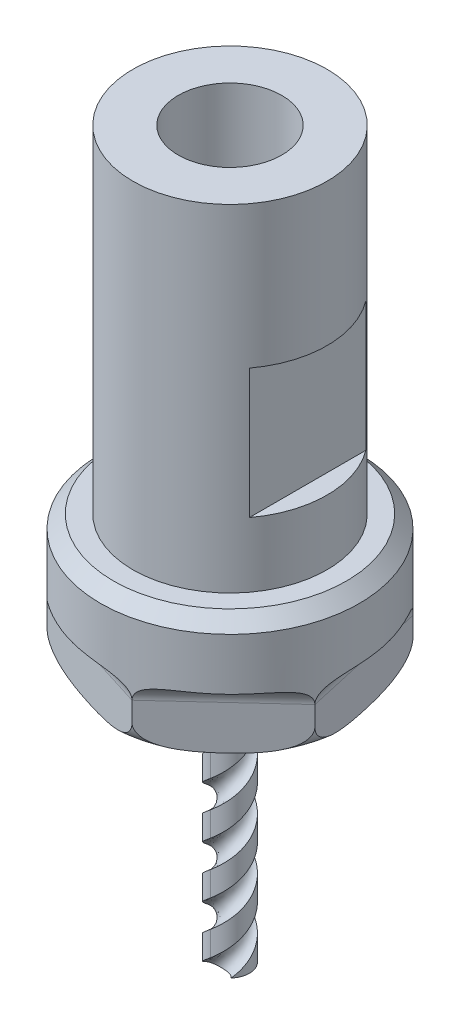
from build123d import *

# Parameters (mm, degrees)
SKETCH_1_R               = 7.5
SKETCH_1_R_2             = 4
EXTRUDE_1_DEPTH          = 26
CUT_EXTRUDE_1_DEPTH      = 10
CUT_EXTRUDE_4_DEPTH      = 5
FILLET_17_R              = 1.5
FILLET_18_R              = 1.5
SKETCH_11_R              = 1.5
EXTRUDE_4_DEPTH          = 20
SWEEP_3_PITCH            = 8
PATTERN_CIRCULAR_1_COUNT = 2


with BuildPart() as part:
    # 草图1 → 凸台-拉伸1 (new body)
    with BuildSketch(Plane(origin=(0, 0, 0), x_dir=(1, 0, 0), z_dir=(0, 1, 0))):
        with Locations(Location((0, 0, 0), (0, 0, 90))):
            Circle(SKETCH_1_R)
        with Locations(Location((0, 0, 0), (0, 0, 90))):
            Circle(SKETCH_1_R_2, mode=Mode.SUBTRACT)
    extrude(amount=EXTRUDE_1_DEPTH)

    # 草图4 → 切除-拉伸1 (cut)
    with BuildSketch(Plane(origin=(0, 5, 0), x_dir=(1, 0, 0), z_dir=(0, 1, 0))):
        with BuildLine():
            Line((-6, 4.5), (-6, -4.5))
            ThreePointArc((-6, -4.5), (-7.5, 0), (-6, 4.5))
        make_face()
        with BuildLine():
            Line((6, 4.5), (6, -4.5))
            ThreePointArc((6, -4.5), (7.5, 0), (6, 4.5))
        make_face()
    extrude(amount=CUT_EXTRUDE_1_DEPTH, mode=Mode.SUBTRACT)

    # 草图9 → 旋转1 (revolve)
    with BuildSketch(Plane.XY, mode=Mode.PRIVATE) as revolve_1_sk:
        with BuildLine():
            Line((0, 0), (9, 0))
            Line((9, 0), (10, -1))
            Line((10, -1), (10, -8))
            ThreePointArc((10, -8), (9.414213562, -9.414213562), (8, -10))
            Line((8, -10), (0, -10))
            Line((0, -10), (0, 0))
        make_face()
    revolve(revolve_1_sk.sketch.rotate(Axis((0, 31.384880557, 0), (0, -1, 0)), 90), axis=Axis((0, 31.384880557, 0), (0, -1, 0)))

    # 草图10 → 切除-拉伸4 (cut)
    with BuildSketch(Plane.XZ.offset(10)):
        with BuildLine():
            Line((9.543902231, 2.985620573), (7.357574378, -6.772451497))
            ThreePointArc((7.357574378, -6.772451497), (9.316000853, -3.634849118), (10, 0))
            ThreePointArc((10, 0), (9.885317959, 1.510128751), (9.543902231, 2.985620573))
        make_face()
        with BuildLine():
            Line((2.186327854, 9.75807207), (9.543902231, 2.985620573))
            ThreePointArc((9.543902231, 2.985620573), (6.772451497, 7.357574378), (2.186327854, 9.75807207))
        make_face()
        with BuildLine():
            Line((-7.357574378, 6.772451497), (2.186327854, 9.75807207))
            ThreePointArc((2.186327854, 9.75807207), (-2.985620573, 9.543902231), (-7.357574378, 6.772451497))
        make_face()
        with BuildLine():
            ThreePointArc((-7.357574378, 6.772451497), (-9.75807207, 2.186327854), (-9.543902231, -2.985620573))
            Line((-9.543902231, -2.985620573), (-7.357574378, 6.772451497))
        make_face()
        with BuildLine():
            ThreePointArc((-9.543902231, -2.985620573), (-6.772451497, -7.357574378), (-2.186327854, -9.75807207))
            Line((-2.186327854, -9.75807207), (-9.543902231, -2.985620573))
        make_face()
        with BuildLine():
            ThreePointArc((-2.186327854, -9.75807207), (2.985620573, -9.543902231), (7.357574378, -6.772451497))
            Line((7.357574378, -6.772451497), (-2.186327854, -9.75807207))
        make_face()
    extrude(amount=-CUT_EXTRUDE_4_DEPTH, mode=Mode.SUBTRACT)

    # 圆角17
    # the kernel refuses this fillet: 1.5 mm, written as the material it adds along each edge
    with BuildSketch(Plane(origin=(10.936537714, -5, -5.652843782), x_dir=(0.29856205726474244, 0, -0.9543902231067984), z_dir=(-0.9543902231067986, 0, -0.29856205726474244))) as fillet_17_piece_1_section:
        with BuildLine():
            CenterArc((FILLET_17_R, FILLET_17_R), FILLET_17_R, 180, 90)
            Line((0, FILLET_17_R), (0, 0))
            Line((0, 0), (FILLET_17_R, 0))
        make_face()
    fillet_17_piece_1 = extrude(amount=17.5, mode=Mode.PRIVATE)
    fillet_17_piece_1 = fillet_17_piece_1 & Plane(origin=(0, -5, 0), x_dir=(0, 0, 1), z_dir=(0, -1, 0)) * Cylinder(10, 42, mode=Mode.PRIVATE)
    fillet_17_piece_1 = split(fillet_17_piece_1, bisect_by=Plane(origin=(2.872004531, -5, -14.414132474), z_dir=(0.6772451497016146, 0, 0.7357574377508104)), keep=Keep.TOP, mode=Mode.PRIVATE)
    fillet_17_piece_1 = split(fillet_17_piece_1, bisect_by=Plane(origin=(7.76751085, -5, -4.942812984), z_dir=(-0.975807206966357, 0, 0.21863278535598768)), keep=Keep.TOP, mode=Mode.PRIVATE)
    add(fillet_17_piece_1)
    with BuildSketch(Plane(origin=(-0.572762538, -5, 12.297741381), x_dir=(0.6772451497016146, 0, 0.7357574377508104), z_dir=(0.7357574377508105, 0, -0.6772451497016146))) as fillet_17_piece_2_section:
        with BuildLine():
            CenterArc((FILLET_17_R, FILLET_17_R), FILLET_17_R, 180, 90)
            Line((0, FILLET_17_R), (0, 0))
            Line((0, 0), (FILLET_17_R, 0))
        make_face()
    fillet_17_piece_2 = extrude(amount=17.5, mode=Mode.PRIVATE)
    fillet_17_piece_2 = fillet_17_piece_2 & Plane(origin=(0, -5, 0), x_dir=(0, 0, 1), z_dir=(0, -1, 0)) * Cylinder(10, 41, mode=Mode.PRIVATE)
    fillet_17_piece_2 = split(fillet_17_piece_2, bisect_by=Plane(origin=(0.396846185, -5, 9.198268212), z_dir=(0.2985620572647422, 0, -0.9543902231067986)), keep=Keep.TOP, mode=Mode.PRIVATE)
    fillet_17_piece_2 = split(fillet_17_piece_2, bisect_by=Plane(origin=(11.04700263, -5, 9.694295121), z_dir=(-0.975807206966357, 0, 0.21863278535598768)), keep=Keep.TOP, mode=Mode.PRIVATE)
    add(fillet_17_piece_2)
    with BuildSketch(Plane(origin=(-10.363775176, -5, -6.644897599), x_dir=(-0.9758072069663569, 0, 0.21863278535598812), z_dir=(0.2186327853559881, 0, 0.9758072069663569))) as fillet_17_piece_3_section:
        with BuildLine():
            CenterArc((FILLET_17_R, FILLET_17_R), FILLET_17_R, 180, 90)
            Line((0, FILLET_17_R), (0, 0))
            Line((0, 0), (FILLET_17_R, 0))
        make_face()
    fillet_17_piece_3 = extrude(amount=17.5, mode=Mode.PRIVATE)
    fillet_17_piece_3 = fillet_17_piece_3 & Plane(origin=(0, -5, 0), x_dir=(0, 0, 1), z_dir=(0, -1, 0)) * Cylinder(10, 42, mode=Mode.PRIVATE)
    fillet_17_piece_3 = split(fillet_17_piece_3, bisect_by=Plane(origin=(-13.919007161, -5, 4.719837353), z_dir=(0.2985620572647422, 0, -0.9543902231067986)), keep=Keep.TOP, mode=Mode.PRIVATE)
    fillet_17_piece_3 = split(fillet_17_piece_3, bisect_by=Plane(origin=(-8.164357035, -5, -4.255455228), z_dir=(0.6772451497016146, 0, 0.7357574377508104)), keep=Keep.TOP, mode=Mode.PRIVATE)
    add(fillet_17_piece_3)

    # 圆角18
    # the kernel refuses this fillet: 1.5 mm, written as the material it adds along each edge
    with BuildSketch(Plane(origin=(0.572762538, -5, -12.297741381), x_dir=(0, -1, 0), z_dir=(-0.7357574377508104, 0, 0.6772451497016146))) as fillet_18_piece_1_section:
        with BuildLine():
            CenterArc((FILLET_18_R, -FILLET_18_R), FILLET_18_R, 90, 90)
            Line((0, -FILLET_18_R), (0, 0))
            Line((0, 0), (FILLET_18_R, 0))
        make_face()
    fillet_18_piece_1 = extrude(amount=17.5, mode=Mode.PRIVATE)
    fillet_18_piece_1 = fillet_18_piece_1 & Plane(origin=(0, -5, 0), x_dir=(0, 0, 1), z_dir=(0, -1, 0)) * Cylinder(10, 41, mode=Mode.PRIVATE)
    add(fillet_18_piece_1)
    with BuildSketch(Plane(origin=(10.363775176, -5, 6.644897599), x_dir=(0, -1, 0), z_dir=(-0.21863278535598768, 0, -0.975807206966357))) as fillet_18_piece_2_section:
        with BuildLine():
            CenterArc((FILLET_18_R, -FILLET_18_R), FILLET_18_R, 90, 90)
            Line((0, -FILLET_18_R), (0, 0))
            Line((0, 0), (FILLET_18_R, 0))
        make_face()
    fillet_18_piece_2 = extrude(amount=17.5, mode=Mode.PRIVATE)
    fillet_18_piece_2 = fillet_18_piece_2 & Plane(origin=(0, -5, 0), x_dir=(0, 0, 1), z_dir=(0, -1, 0)) * Cylinder(10, 42, mode=Mode.PRIVATE)
    add(fillet_18_piece_2)
    with BuildSketch(Plane(origin=(-10.936537714, -5, 5.652843782), x_dir=(0, -1, 0), z_dir=(0.9543902231067986, 0, 0.2985620572647422))) as fillet_18_piece_3_section:
        with BuildLine():
            CenterArc((FILLET_18_R, -FILLET_18_R), FILLET_18_R, 90, 90)
            Line((0, -FILLET_18_R), (0, 0))
            Line((0, 0), (FILLET_18_R, 0))
        make_face()
    fillet_18_piece_3 = extrude(amount=17.5, mode=Mode.PRIVATE)
    fillet_18_piece_3 = fillet_18_piece_3 & Plane(origin=(0, -5, 0), x_dir=(0, 0, 1), z_dir=(0, -1, 0)) * Cylinder(10, 41, mode=Mode.PRIVATE)
    add(fillet_18_piece_3)

    # 草图11 → 凸台-拉伸4 (add)
    with BuildSketch(Plane.XZ.offset(10)):
        with Locations(Location((0, 0, 0), (0, 0, 90))):
            Circle(SKETCH_11_R)
    extrude(amount=EXTRUDE_4_DEPTH)

    # 切除-扫描3: arcs per turn and ends read off the stored shape
    # 切除-扫描3: the profile of 草图15 screwed along a right-hand helix through 3 turns, 14 arcs to a turn; built about Z, then put on its axis
    sweep_3_z = Axis((0, 0, 0), (0, 0, 1))
    sweep_3_corners = [(1.5, 0, -8), (2.065685425, 0.36607134, -8.431267637), (0.934314575, 0.36607134, -8.431267637), (0.934314575, -0.36607134, -7.568732363), (2.065685425, -0.36607134, -7.568732363)]
    with BuildLine(mode=Mode.PRIVATE) as sweep_3_profile:
        Line(sweep_3_corners[0], sweep_3_corners[1])
        Line(sweep_3_corners[4], sweep_3_corners[0])
        ThreePointArc((2.065685425, 0.36607134, -8.431267637), (1.5, 0.517703053, -8.609904541), (0.934314575, 0.36607134, -8.431267637))
        ThreePointArc((0.934314575, 0.36607134, -8.431267637), (0.7, 0, -8), (0.934314575, -0.36607134, -7.568732363))
        ThreePointArc((0.934314575, -0.36607134, -7.568732363), (1.5, -0.517703053, -7.390095459), (2.065685425, -0.36607134, -7.568732363))
    sweep_3_cap = Face(sweep_3_profile.wire())
    sweep_3_arcs = [((2.065685425, 0.36607134, -8.431267637), (1.5, 0.732142679, -8.862535273), (0.934314575, 0.36607134, -8.431267637), (1, 0.7071067811865475, 1)), ((0.934314575, 0.36607134, -8.431267637), (0.36862915, 0, -8), (0.934314575, -0.36607134, -7.568732363), (1, 0.7071067811865475, 1)), ((0.934314575, -0.36607134, -7.568732363), (1.5, -0.732142679, -7.137464727), (2.065685425, -0.36607134, -7.568732363), (1, 0.7071067811865475, 1))]  # start, shoulder, end, weights
    sweep_3_turn_angles = [0, 12.857142857, 25.714285714, 38.571428571, 51.428571429, 64.285714286, 77.142857143, 90, 102.857142857, 115.714285714, 128.571428571, 141.428571429, 154.285714286, 167.142857143, 180, 192.857142857, 205.714285714, 218.571428571, 231.428571429, 244.285714286, 257.142857143, 270, 282.857142857, 295.714285714, 308.571428571, 321.428571429, 334.285714286, 347.142857143, 360]
    sweep_3_turn_weights = [1, 0.9749279121818236, 1, 0.9749279121818236, 1, 0.9749279121818236, 1, 0.9749279121818236, 1, 0.9749279121818236, 1, 0.9749279121818236, 1, 0.9749279121818236, 1, 0.9749279121818236, 1, 0.9749279121818236, 1, 0.9749279121818236, 1, 0.9749279121818236, 1, 0.9749279121818237, 1, 0.9749279121818236, 1, 0.9749279121818236, 1]
    sweep_3_turn_rails = [Edge.make_bspline([Vector(p[0], p[1], 0).rotate(sweep_3_z, sweep_3_turn_angles[k]) / sweep_3_turn_weights[k] + Vector(0, 0, p[2] + SWEEP_3_PITCH * sweep_3_turn_angles[k] / 360) for k in range(29)], [0, 0, 0, 1, 1, 2, 2, 3, 3, 4, 4, 5, 5, 6, 6, 7, 7, 8, 8, 9, 9, 10, 10, 11, 11, 12, 12, 13, 13, 14, 14, 14], 2, sweep_3_turn_weights) for p in sweep_3_corners]
    sweep_3_turn_sides = [*[Face.make_surface_from_curves(sweep_3_turn_rails[p[0]], sweep_3_turn_rails[p[1]]) for p in [(0, 1), (4, 0)]], *[Face.make_bezier_surface([[Vector(p[j][0], p[j][1], 0).rotate(sweep_3_z, sweep_3_turn_angles[2 * i + k]) / sweep_3_turn_weights[2 * i + k] + Vector(0, 0, p[j][2] + SWEEP_3_PITCH * sweep_3_turn_angles[2 * i + k] / 360) for k in range(3)] for j in range(3)], [[p[3][j] * sweep_3_turn_weights[2 * i + k] for k in range(3)] for j in range(3)]) for p in sweep_3_arcs for i in range(14)]]
    sweep_3 = Plane(origin=(0, -30, 0), x_dir=(0, 0, -1), z_dir=(0, 1, 0)) * Solid(Shell([*[p.moved(Location((0, 0, SWEEP_3_PITCH * i))) for i in range(3) for p in sweep_3_turn_sides], sweep_3_cap, sweep_3_cap.rotate(sweep_3_z, 1080).moved(Location((0, 0, SWEEP_3_PITCH * 1080 / 360)))]))
    add(sweep_3, mode=Mode.SUBTRACT)

    # 阵列(圆周)1: 切除-扫描3 ×2 about axis
    pattern_circular_1_axis = Axis((0, 28.865544748, 0), (0, -1, 0))
    for i in range(1, PATTERN_CIRCULAR_1_COUNT):
        add(sweep_3.rotate(pattern_circular_1_axis, i * 360 / PATTERN_CIRCULAR_1_COUNT), mode=Mode.SUBTRACT)


solid = part.part
